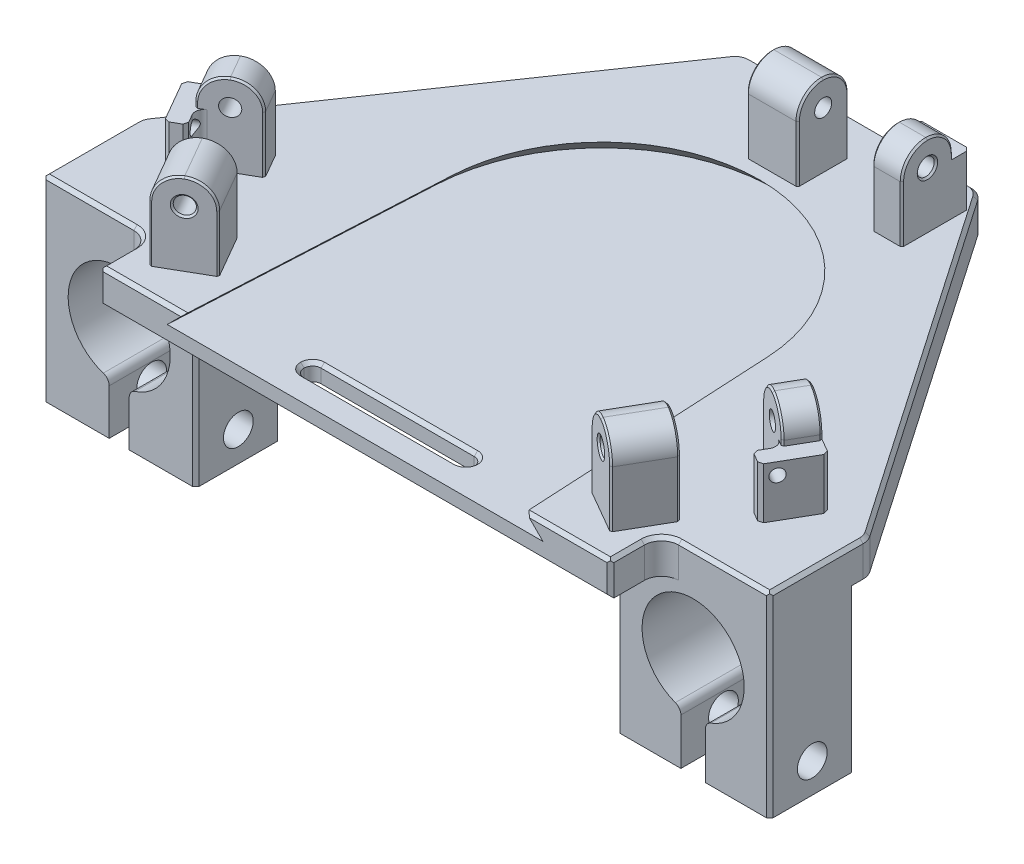
from build123d import *

# Parameters (mm, degrees)
SKETCH1_R                = 20
BOSS_EXTRUDE1_DEPTH      = 1
SKETCH3_W                = 3
SKETCH3_H                = 3
BOSS_EXTRUDE2_DEPTH      = 4.8
FILLET1_R                = 1.5
SKETCH4_R                = 0.5
CUT_EXTRUDE1_DEPTH       = 29.872824593
CIRPATTERN1_COUNT        = 3
FILLET1_OF_CIRPATTERN1_R = 1.5
BOSS_EXTRUDE6_DEPTH      = 2
CUT_EXTRUDE15_DEPTH      = 27
FILLET28_R               = 5
FILLET30_R               = 5
SKETCH12_W               = 9
SKETCH12_H               = 5
BOSS_EXTRUDE11_DEPTH     = 9.5
SKETCH36_R               = 3
CUT_EXTRUDE16_DEPTH      = 40.5
SKETCH41_W               = 1.75
SKETCH41_H               = 3
BOSS_EXTRUDE12_DEPTH     = 4.8
SKETCH48_W               = 3
SKETCH48_H               = 3
BOSS_EXTRUDE13_DEPTH     = 1
SKETCH49_W               = 3
SKETCH49_H               = 3
BOSS_EXTRUDE14_DEPTH     = 1
SKETCH50_W               = 3
SKETCH50_H               = 3
BOSS_EXTRUDE15_DEPTH     = 1
FILLET47_R               = 1.5
SKETCH42_R               = 0.5
CUT_EXTRUDE20_DEPTH      = 10
SKETCH43_R               = 0.5
CUT_EXTRUDE21_DEPTH      = 10
CUT_EXTRUDE22_START      = -10
SKETCH44_R               = 0.5
CUT_EXTRUDE22_DEPTH      = 10
SKETCH46_R               = 0.875
CUT_EXTRUDE23_DEPTH      = 51.492139351
SKETCH47_W               = 1.176481785
SKETCH47_H               = 10.74600376
SKETCH47_W_2             = 1.36989631
SKETCH47_W_3             = 1.437294726
CUT_EXTRUDE24_DEPTH      = 39.217742009
FILLET48_R               = 0.5
SKETCH51_R               = 0.375
CUT_EXTRUDE25_DEPTH      = 10.5
SKETCH53_R               = 0.375
CUT_EXTRUDE26_DEPTH      = 10.5
SKETCH52_R               = 0.375
CUT_EXTRUDE27_DEPTH      = 10.5
CHAMFER1_SIZE            = 0.1
CHAMFER2_SIZE            = 0.1
SKETCH54_W               = 53.79472753
SKETCH54_H               = 13.774888828
CUT_EXTRUDE28_DEPTH      = 9
CUT_EXTRUDE29_DEPTH      = 1
CUT_EXTRUDE29_DRAFT      = 45
CHAMFER3_SIZE            = 0.1
FILLET49_R               = 0.5
SKETCH57_OUTSIDE_W       = 61.414
SKETCH57_OUTSIDE_H       = 44.818
CUT_EXTRUDE31_DEPTH      = 3
SKETCH56_W               = 10
SKETCH56_H               = 1
CUT_EXTRUDE30_DEPTH      = 3
FILLET50_R               = 0.5
CHAMFER5_SIZE            = 0.2
FILLET51_R               = 1
CHAMFER4_SIZE            = 0.2
CHAMFER7_SIZE            = 0.2
FILLET52_R               = 1
CHAMFER6_SIZE            = 0.2


# Some blends are built 0.0001 mm under size
with BuildPart() as part:
    # Sketch1 → Boss-Extrude1 (new, symmetric)
    with BuildSketch(Plane(origin=(0, 0, 0), x_dir=(1, 0, 0), z_dir=(0, 1, 0))):
        with Locations(Location((0, 0, 0), (0, 0, 270))):
            Circle(SKETCH1_R)
    extrude(amount=BOSS_EXTRUDE1_DEPTH, both=True)

    # Sketch3 → Boss-Extrude2 (add)
    with BuildSketch(Plane(origin=(0, 1, 0), x_dir=(1, 0, 0), z_dir=(0, 1, 0))):
        with Locations((0, 15)):
            Rectangle(SKETCH3_W, SKETCH3_H)
    boss_extrude2 = extrude(amount=BOSS_EXTRUDE2_DEPTH)

    # Fillet1
    fillet1_edges = [part.edges().sort_by_distance(p)[0] for p in [
        (0, 5.8, -16.5),
        (0, 5.8, -13.5),
    ]]
    fillet(fillet1_edges, radius=FILLET1_R - 0.0001)  # a hair under: the kernel refuses the full size

    # Sketch4 → Cut-Extrude1 (cut, symmetric)
    with BuildSketch(Plane.ZY):
        with Locations((-15, 4.3)):
            Circle(SKETCH4_R)
    cut_extrude1 = extrude(amount=CUT_EXTRUDE1_DEPTH, both=True, mode=Mode.SUBTRACT)

    # CirPattern1: Boss-Extrude2, Cut-Extrude1 ×3 about axis
    cirpattern1_axis = Axis((0, 0, 0), (0, 1, 0))
    add([boss_extrude2.rotate(cirpattern1_axis, i * 360 / CIRPATTERN1_COUNT) for i in range(1, CIRPATTERN1_COUNT)])
    add([cut_extrude1.rotate(cirpattern1_axis, i * 360 / CIRPATTERN1_COUNT) for i in range(1, CIRPATTERN1_COUNT)], mode=Mode.SUBTRACT)

    # Fillet1 of CirPattern1
    fillet1_of_cirpattern1_edges = [part.edges().sort_by_distance(p)[0] for p in [
        (-14.289419162, 5.8, 8.25),
        (-11.691342951, 5.8, 6.75),
        (14.289419162, 5.8, 8.25),
        (11.691342951, 5.8, 6.75),
    ]]
    fillet(fillet1_of_cirpattern1_edges, radius=FILLET1_OF_CIRPATTERN1_R - 0.0001)  # a hair under: the kernel refuses the full size

    # Sketch14 → Boss-Extrude6 (add)
    with BuildSketch(Plane(origin=(0, 1, 0), x_dir=(1, 0, 0), z_dir=(0, 1, 0))):
        with BuildLine():
            ThreePointArc((-12.99118366, -15.206220672), (-18.163475345, -8.371867379), (-20, 0))
            Line((-20, 0), (-23.806849355, -4.715224683))
            Line((-23.806849355, -4.715224683), (-23.806849355, -8.719174362))
            Line((-23.806849355, -8.719174362), (-12.99118366, -15.206220672))
        make_face()
        with BuildLine():
            Line((12.99118366, -15.206220672), (23.806849355, -8.719174362))
            Line((23.806849355, -8.719174362), (23.806849355, -4.715224683))
            Line((23.806849355, -4.715224683), (20, 0))
            ThreePointArc((20, 0), (18.163475345, -8.371867379), (12.99118366, -15.206220672))
        make_face()
    extrude(amount=-BOSS_EXTRUDE6_DEPTH)

    # Sketch35 → Cut-Extrude15 (cut)
    with BuildSketch(Plane(origin=(0, 1, 0), x_dir=(1, 0, 0), z_dir=(0, 1, 0))):
        with BuildLine():
            Line((-20, 0), (-8.719101331, 17.999368655))
            ThreePointArc((-8.719101331, 17.999368655), (-18.922490972, 11.859455035), (-20, 0))
        make_face()
        with BuildLine():
            Line((8.719101331, 17.999368655), (20, 0))
            ThreePointArc((20, 0), (19.339121725, 12.120573599), (8.719101331, 17.999368655))
        make_face()
    extrude(amount=-CUT_EXTRUDE15_DEPTH, mode=Mode.SUBTRACT)

    # Fillet28
    fillet28_edges = [part.edges().sort_by_distance(p)[0] for p in [
        (-8.719101331, 0, -17.999368655),
        (8.719101331, 0, -17.999368655),
    ]]
    fillet(fillet28_edges, radius=FILLET28_R)

    # Fillet30
    # the kernel refuses this fillet: 5 mm, written as the material it adds along each edge
    with BuildSketch(Plane(origin=(20, 1, 0), x_dir=(-0.5310578751225382, 0, -0.8473355493960669), z_dir=(0, -1, 0))) as fillet30_piece_1:
        with BuildLine():
            CenterArc((FILLET30_R * 0.0597507997146, FILLET30_R), FILLET30_R, 263.161193514, 6.838806486)
            Line((-FILLET30_R * 0.0593256778676, FILLET30_R * 0.00711491476272), (0, 0))
            Line((0, 0), (FILLET30_R * 0.0597507997145, 0))
        make_face()
    extrude(amount=2)
    with BuildSketch(Plane(origin=(-20, 1, 0), x_dir=(0.5310578751225483, 0, -0.8473355493960607), z_dir=(0, -1, 0))) as fillet30_piece_2:
        with BuildLine():
            CenterArc((FILLET30_R * 0.0597507997145, -FILLET30_R), FILLET30_R, 90, 6.838806486)
            Line((-FILLET30_R * 0.0593256778676, -FILLET30_R * 0.00711491476272), (0, 0))
            Line((0, 0), (FILLET30_R * 0.0597507997145, 0))
        make_face()
    extrude(amount=2)
    # the kernel refuses this fillet: 5 mm, written as the material it takes off along each edge
    with BuildSketch(Plane(origin=(-23.806849355, 8.078700281, 8.719174362), x_dir=(0, 0, -1), z_dir=(0, -1, 0)), Plane(origin=(23.806849355, 8.078700281, 8.719174362), x_dir=(-0.8575752286007334, 0, 0.514358559071782), z_dir=(0, -1, 0))) as fillet30_2_piece_1:
        with BuildLine():
            CenterArc((FILLET30_R * 0.566296022473, FILLET30_R), FILLET30_R, 210.954589815, 59.045410185)
            Line((-FILLET30_R * 0.291279206127, FILLET30_R * 0.485641440928), (0, 0))
            Line((0, 0), (FILLET30_R * 0.566296022473, 0))
        make_face()
    extrude(amount=16.157400562, mode=Mode.SUBTRACT)
    with BuildSketch(Plane(origin=(-23.806849355, 5.416144051, 4.715224683), x_dir=(0.6281771761591642, 0, -0.7780703280248503), z_dir=(0, -1, 0))) as fillet30_2_piece_2:
        with BuildLine():
            CenterArc((FILLET30_R * 0.353291524108, FILLET30_R), FILLET30_R, 231.084234427, 38.915765573)
            Line((-FILLET30_R * 0.274885652051, FILLET30_R * 0.221929671975), (0, 0))
            Line((0, 0), (FILLET30_R * 0.353291524108, 0))
        make_face()
    extrude(amount=10.832288103, mode=Mode.SUBTRACT)
    with BuildSketch(Plane(origin=(23.806849355, 5.416144051, 4.715224683), x_dir=(-0.6281771761591636, 0, -0.778070328024851), z_dir=(0, -1, 0))) as fillet30_2_piece_3:
        with BuildLine():
            CenterArc((FILLET30_R * 0.353291524108, -FILLET30_R), FILLET30_R, 90, 38.915765573)
            Line((-FILLET30_R * 0.274885652051, -FILLET30_R * 0.221929671975), (0, 0))
            Line((0, 0), (FILLET30_R * 0.353291524108, 0))
        make_face()
    extrude(amount=10.832288103, mode=Mode.SUBTRACT)

    # Sketch12 → Boss-Extrude11 (add)
    with BuildSketch(Plane.XZ.offset(1)):
        with Locations((-16.859549072, 5.5)):
            Rectangle(SKETCH12_W, SKETCH12_H)
        with Locations((16.859549072, 5.5)):
            Rectangle(SKETCH12_W, SKETCH12_H)
        with Locations((-1.5, -16.25)):
            Rectangle(SKETCH12_W, SKETCH12_H)
    extrude(amount=BOSS_EXTRUDE11_DEPTH)

    # Sketch36 → Cut-Extrude16 (cut, symmetric)
    with BuildSketch(Plane(origin=(0, 0, 3), x_dir=(-1, 0, 0), z_dir=(0, 0, -1))):
        with Locations((-16.859549072, -4.5)):
            Circle(SKETCH36_R)
        with Locations((16.859549072, -4.5)):
            Circle(SKETCH36_R)
        with Locations((1.5, -4.5)):
            Circle(SKETCH36_R)
    extrude(amount=CUT_EXTRUDE16_DEPTH, both=True, mode=Mode.SUBTRACT)

    # Sketch41 → Boss-Extrude12 (add)
    with BuildSketch(Plane(origin=(0, 1, 0), x_dir=(1, 0, 0), z_dir=(0, 1, 0))):
        with Locations((6.75, 15)):
            Rectangle(SKETCH41_W, SKETCH41_H)
        Polygon((15.503842951, -0.146556296), (18.101919162, -1.646556296), (17.226919162, -3.162100753), (14.628842951, -1.662100753), align=None)
        Polygon((-14.628842951, -1.662100753), (-15.503842951, -0.146556296), (-18.101919162, -1.646556296), (-17.226919162, -3.162100753), align=None)
    extrude(amount=BOSS_EXTRUDE12_DEPTH)

    # Sketch48 → Boss-Extrude13 (add)
    with BuildSketch(Plane(origin=(0, 0, -16.5), x_dir=(-1, 0, 0), z_dir=(0, 0, -1))):
        with Locations((-6.125, 2.5)):
            Rectangle(SKETCH48_W, SKETCH48_H)
    extrude(amount=BOSS_EXTRUDE13_DEPTH)

    # Sketch49 → Boss-Extrude14 (add)
    with BuildSketch(Plane(origin=(14.289419162, 0, 8.25), x_dir=(0.5000000000000007, 0, -0.8660254037844384), z_dir=(0.8660254037844383, 0, 0.5000000000000006))):
        with Locations((6.125, 2.5)):
            Rectangle(SKETCH49_W, SKETCH49_H)
    extrude(amount=BOSS_EXTRUDE14_DEPTH)

    # Sketch50 → Boss-Extrude15 (add)
    with BuildSketch(Plane(origin=(-14.289419162, 0, 8.25), x_dir=(0.5000000000000007, 0, 0.8660254037844384), z_dir=(-0.8660254037844383, 0, 0.5000000000000006))):
        with Locations((-6.125, 2.5)):
            Rectangle(SKETCH50_W, SKETCH50_H)
    extrude(amount=BOSS_EXTRUDE15_DEPTH)

    # Fillet47
    fillet47_edges = [part.edges().sort_by_distance(p)[0] for p in [
        (6.75, 5.8, -16.5),
        (6.75, 5.8, -13.5),
        (15.066342951, 5.8, 0.904328524),
        (17.664419162, 5.8, 2.404328524),
        (-15.066342951, 5.8, 0.904328524),
        (-17.664419162, 5.8, 2.404328524),
    ]]
    fillet(fillet47_edges, radius=FILLET47_R - 0.0001)  # a hair under: the kernel refuses the full size

    # Sketch42 → Cut-Extrude20 (cut)
    with BuildSketch(Plane.ZY.offset(-5.875)):
        with Locations((-15, 4.3)):
            Circle(SKETCH42_R)
    extrude(amount=-CUT_EXTRUDE20_DEPTH, mode=Mode.SUBTRACT)

    # Sketch43 → Cut-Extrude21 (cut)
    with BuildSketch(Plane(origin=(-2.9375, 0, -5.087899247), x_dir=(0.8660254037844387, 0, -0.4999999999999999), z_dir=(0.49999999999999994, 0, 0.8660254037844388))):
        with Locations((-15, 4.3)):
            Circle(SKETCH43_R)
    extrude(amount=-CUT_EXTRUDE21_DEPTH, mode=Mode.SUBTRACT)

    # Sketch44 → Cut-Extrude22 (cut)
    with BuildSketch(Plane(origin=(2.9375, 0, -5.087899247), x_dir=(0.8660254037844387, 0, 0.49999999999999983), z_dir=(-0.49999999999999983, 0, 0.8660254037844387)).offset(CUT_EXTRUDE22_START)):
        with Locations(Location((15, 4.3, 0), (0, 0, 180))):
            Circle(SKETCH44_R)
    extrude(amount=CUT_EXTRUDE22_DEPTH, mode=Mode.SUBTRACT)

    # Sketch46 → Cut-Extrude23 (cut, through all)
    with BuildSketch(Plane.ZY.offset(21.359549072)):
        with Locations((5.5, -8.75)):
            Circle(SKETCH46_R)
        with Locations((-16.25, -8.75)):
            Circle(SKETCH46_R)
    extrude(amount=-CUT_EXTRUDE23_DEPTH, mode=Mode.SUBTRACT)

    # Sketch47 → Cut-Extrude24 (cut, through all)
    with BuildSketch(Plane.XY.offset(8)):
        with Locations((-16.859549072, -10.5)):
            Rectangle(SKETCH47_W, SKETCH47_H)
        with Locations((-1.5, -10.5)):
            Rectangle(SKETCH47_W_2, SKETCH47_H)
        with Locations((16.859549072, -10.5)):
            Rectangle(SKETCH47_W_3, SKETCH47_H)
    extrude(amount=-CUT_EXTRUDE24_DEPTH, mode=Mode.SUBTRACT)

    # Fillet48
    fillet48_edges = [part.edges().sort_by_distance(p)[0] for p in [
        (5.875, 2.5, -16.5),
        (17.226919162, 2.5, 3.162100753),
        (-17.226919162, 2.5, 3.162100753),
    ]]
    fillet(fillet48_edges, radius=FILLET48_R)

    # Sketch51 → Cut-Extrude25 (cut)
    with BuildSketch(Plane(origin=(-15.155444566, 0, 8.75), x_dir=(0.5000000000000008, 0, 0.8660254037844383), z_dir=(-0.8660254037844382, 0, 0.5000000000000007))):
        with Locations((-5.425, 3.3)):
            Circle(SKETCH51_R)
    extrude(amount=-CUT_EXTRUDE25_DEPTH, mode=Mode.SUBTRACT)

    # Sketch53 → Cut-Extrude26 (cut)
    with BuildSketch(Plane(origin=(15.155444566, 0, 8.75), x_dir=(0.5000000000000006, 0, -0.8660254037844384), z_dir=(0.8660254037844384, 0, 0.5000000000000006))):
        with Locations((5.425, 3.3)):
            Circle(SKETCH53_R)
    extrude(amount=-CUT_EXTRUDE26_DEPTH, mode=Mode.SUBTRACT)

    # Sketch52 → Cut-Extrude27 (cut)
    with BuildSketch(Plane(origin=(0, 0, -17.5), x_dir=(-1, 0, 0), z_dir=(0, 0, -1))):
        with Locations((-5.425, 3.3)):
            Circle(SKETCH52_R)
    extrude(amount=-CUT_EXTRUDE27_DEPTH, mode=Mode.SUBTRACT)

    # Chamfer1
    chamfer1_edges = [part.edges().sort_by_distance(p)[0] for p in [
        (-1.5, 2.65005, -13.5),
        (-1.5, 2.65005, -16.5),
        (-1.5, 5.360689461, -13.939310539),
        (-1.5, 5.360689461, -16.060689461),
        (1.5, 2.65005, -16.5),
        (1.5, 2.65005, -13.5),
        (1.5, 5.360689461, -13.939310539),
        (1.5, 5.360689461, -16.060689461),
        (12.441342951, 2.65005, 5.450961894),
        (15.039419162, 2.65005, 6.950961894),
        (12.821797038, 5.360689461, 5.670617164),
        (14.658965076, 5.360689461, 6.731306625),
        (13.539419162, 2.65005, 9.549038106),
        (10.941342951, 2.65005, 8.049038106),
        (11.321797038, 5.360689461, 8.268693375),
        (13.158965076, 5.360689461, 9.329382836),
        (-10.941342951, 2.65005, 8.049038106),
        (-13.539419162, 2.65005, 9.549038106),
        (-11.321797038, 5.360689461, 8.268693375),
        (-13.158965076, 5.360689461, 9.329382836),
        (-15.039419162, 2.65005, 6.950961894),
        (-12.441342951, 2.65005, 5.450961894),
        (-12.821797038, 5.360689461, 5.670617164),
        (-14.658965076, 5.360689461, 6.731306625),
    ]]
    chamfer(chamfer1_edges, length=CHAMFER1_SIZE)

    # Chamfer2
    chamfer2_edges = [part.edges().sort_by_distance(p)[0] for p in [
        (5.875, 2.65005, -13.5),
        (5.875, 4.15005, -16.5),
        (5.875, 5.360689461, -13.939310539),
        (5.875, 5.360689461, -16.060689461),
        (7.625, 4.15005, -16.5),
        (7.625, 2.65005, -13.5),
        (7.625, 5.360689461, -13.939310539),
        (7.625, 5.360689461, -16.060689461),
        (17.226919162, 4.15005, 3.162100753),
        (14.628842951, 2.65005, 1.662100753),
        (16.846465076, 5.360689461, 2.942445483),
        (15.009297038, 5.360689461, 1.881756022),
        (15.503842951, 2.65005, 0.146556296),
        (18.101919162, 4.15005, 1.646556296),
        (17.721465076, 5.360689461, 1.426901027),
        (15.884297038, 5.360689461, 0.366211566),
        (-18.101919162, 4.15005, 1.646556296),
        (-15.503842951, 2.65005, 0.146556296),
        (-17.721465076, 5.360689461, 1.426901027),
        (-15.884297038, 5.360689461, 0.366211566),
        (-14.628842951, 2.65005, 1.662100753),
        (-17.226919162, 4.15005, 3.162100753),
        (-16.846465076, 5.360689461, 2.942445483),
        (-15.009297038, 5.360689461, 1.881756022),
    ]]
    chamfer(chamfer2_edges, length=CHAMFER2_SIZE)

    # Sketch54 → Cut-Extrude28 (cut)
    with BuildSketch(Plane.XY.offset(20)):
        Rectangle(SKETCH54_W, SKETCH54_H)
    extrude(amount=-CUT_EXTRUDE28_DEPTH, mode=Mode.SUBTRACT)


with BuildPart() as cut_extrude29_tool:
    # Sketch55 → Cut-Extrude29 (with draft: the straight prism first)
    with BuildSketch(Plane(origin=(0, 1, 0), x_dir=(1, 0, 0), z_dir=(0, 1, 0))):
        with BuildLine():
            Line((-10.035318621, -11), (10.035318621, -11))
            Line((10.035318621, -11), (9.25, 3.984771958))
            ThreePointArc((9.25, 3.984771958), (0, 12.7626942), (-9.25, 3.984771958))
            Line((-9.25, 3.984771958), (-10.035318621, -11))
        make_face()
    extrude(amount=-CUT_EXTRUDE29_DEPTH)
    # Cut-Extrude29: the draft: its side faces are tilted about the plane it starts from
    cut_extrude29_sides = [cut_extrude29_tool.faces().sort_by_distance(p)[0] for p in [
        (-9.642659311, 0.5, 3.507614021),
        (0, 0.5, 11),
        (9.642659311, 0.5, 3.507614021),
        (0, 0.5, -12.7626942),
    ]]
    draft(cut_extrude29_sides, Plane(origin=(0, 1, 0), x_dir=(1, 0, 0), z_dir=(0, 1, 0)), CUT_EXTRUDE29_DRAFT)


with BuildPart() as part_1:
    add(part.part)

    # Cut-Extrude29: cut by cut_extrude29_tool
    add(cut_extrude29_tool.part, mode=Mode.SUBTRACT)

    # Chamfer3
    chamfer3_edges = [part_1.edges().sort_by_distance(p)[0] for p in [
        (-1.5, 4.3, -15.5),
        (7.625, 4.3, -15.5),
        (-17.235893759, 4.3, 1.146556296),
        (17.235893759, 4.3, 1.146556296),
        (12.673393759, 4.3, 9.049038106),
        (-12.673393759, 4.3, 9.049038106),
    ]]
    chamfer(chamfer3_edges, length=CHAMFER3_SIZE)

    # Fillet49
    fillet49_edges = [part_1.edges().sort_by_distance(p)[0] for p in [
        (-16.271308179, -7.441763528, 5.5),
        (-17.447789964, -7.441763528, 5.5),
        (-0.815051845, -7.420761206, -16.25),
        (-2.184948155, -7.420761206, -16.25),
        (17.578196435, -7.412652737, 5.5),
        (16.140901709, -7.412652737, 5.5),
    ]]
    fillet(fillet49_edges, radius=FILLET49_R)

    # Sketch57 outside → Cut-Extrude31 (cut)
    with BuildSketch(Plane.XZ.offset(1)):
        with Locations((0, -4.5)):
            Rectangle(SKETCH57_OUTSIDE_W, SKETCH57_OUTSIDE_H)
        Polygon((-15, 11), (-15, 8), (-21.359549072, 8), (-21.359549072, 2.2), (-6.959705454, -18.75), (6.959705454, -18.75), (21.359549072, 2.2), (21.359549072, 8), (15, 8), (15, 11), align=None, mode=Mode.SUBTRACT)
    extrude(amount=-CUT_EXTRUDE31_DEPTH, mode=Mode.SUBTRACT)

    # Sketch56 → Cut-Extrude30 (cut)
    with BuildSketch(Plane(origin=(0, 0, 0), x_dir=(1, 0, 0), z_dir=(0, 1, 0))):
        with Locations((0, -9)):
            Rectangle(SKETCH56_W, SKETCH56_H)
    extrude(amount=-CUT_EXTRUDE30_DEPTH, mode=Mode.SUBTRACT)

    # Fillet50
    fillet50_edges = [part_1.edges().sort_by_distance(p)[0] for p in [
        (5, -0.5, 9.5),
        (5, -0.5, 8.5),
        (-5, -0.5, 8.5),
        (-5, -0.5, 9.5),
    ]]
    fillet(fillet50_edges, radius=FILLET50_R - 0.0001)  # a hair under: the kernel refuses the full size

    # Chamfer5
    chamfer5_edges = [part_1.edges().sort_by_distance(p)[0] for p in [
        (4.625, 2.5, -16.5),
        (7.625, 2.5, -17.5),
        (4.625, 2.5, -17.5),
        (16.601919162, 2.5, 4.244632507),
        (18.967944566, 2.5, 2.146556296),
        (17.467944566, 2.5, 4.744632507),
        (-16.601919162, 2.5, 4.244632507),
        (-18.967944566, 2.5, 2.146556296),
        (-17.467944566, 2.5, 4.744632507),
    ]]
    chamfer(chamfer5_edges, length=CHAMFER5_SIZE)

    # Fillet51
    fillet51_edges = [part_1.edges().sort_by_distance(p)[0] for p in [
        (15, 0, 8),
        (-15, 0, 8),
    ]]
    fillet(fillet51_edges, radius=FILLET51_R)

    # Chamfer4
    chamfer4_edges = [part_1.edges().sort_by_distance(p)[0] for p in [
        (-21.359549072, -4.75, 8),
        (-21.359549072, -5.75, 3),
        (-12.359549072, -5.75, 3),
        (-12.359549072, -5.75, 8),
        (21.359549072, -5.75, 3),
        (21.359549072, -4.75, 8),
        (12.359549072, -5.75, 8),
        (12.359549072, -5.75, 3),
        (-6, -5.75, -13.75),
        (-6, -5.75, -18.75),
        (3, -5.75, -18.75),
        (3, -5.75, -13.75),
    ]]
    chamfer(chamfer4_edges, length=CHAMFER4_SIZE)

    # Chamfer7
    chamfer7_edges = [part_1.edges().sort_by_distance(p)[0] for p in [
        (15, 0, 11),
        (-15, 0, 11),
    ]]
    chamfer(chamfer7_edges, length=CHAMFER7_SIZE)

    # Fillet52
    fillet52_edges = [part_1.edges().sort_by_distance(p)[0] for p in [
        (21.359549072, 0, 2.2),
        (6.959705454, 0, -18.75),
        (-6.959705454, 0, -18.75),
        (-21.359549072, 0, 2.2),
    ]]
    fillet(fillet52_edges, radius=FILLET52_R)

    # Chamfer6
    # the kernel refuses this chamfer: 0.2 mm, written as the material it takes off along each edge
    with BuildSketch(Plane(origin=(-4.5001, 0, 8.5), x_dir=(0, 0.027495876610586487, -0.9996219169112966), z_dir=(1, 0, 0)), Plane(origin=(4.5001, 0, 9.5), x_dir=(0, 0.027495876610586487, 0.9996219169112966), z_dir=(-1, 0, 0))) as chamfer6_piece_1:
        Polygon((CHAMFER6_SIZE * 0.999621916911, -CHAMFER6_SIZE * 0.0274958766106), (-CHAMFER6_SIZE * 0.0274958766106, -CHAMFER6_SIZE * 0.999621916911), (0, 0), align=None)
    extrude(amount=9.0002, mode=Mode.SUBTRACT)
    with BuildSketch(Plane(origin=(-4.5001, 0, 8.9999), x_dir=(-1, 0, 0), z_dir=(0, 0, 1))) as chamfer6_piece_2:
        Polygon((0.4999 + CHAMFER6_SIZE, 0), (0.4999, CHAMFER6_SIZE), (0.4999, 0), align=None)
    revolve(axis=Axis((-4.5001, 0, 8.9999), (0, -1, 0)), revolution_arc=90, mode=Mode.SUBTRACT)
    with BuildSketch(Plane(origin=(4.5001, 0, 8.9999), x_dir=(1, 0, 0), z_dir=(0, 0, 1))) as chamfer6_piece_3:
        Polygon((0.4999 + CHAMFER6_SIZE, 0), (0.4999, -CHAMFER6_SIZE), (0.4999, 0), align=None)
    revolve(axis=Axis((4.5001, 0, 8.9999), (0, 1, 0)), revolution_arc=90, mode=Mode.SUBTRACT)
    with BuildSketch(Plane(origin=(-4.5001, 0, 9.0001), x_dir=(-1, 0, 0), z_dir=(0, 0, -1))) as chamfer6_piece_4:
        Polygon((0.4999 + CHAMFER6_SIZE, 0), (0.4999, -CHAMFER6_SIZE), (0.4999, 0), align=None)
    revolve(axis=Axis((-4.5001, 0, 9.0001), (0, 1, 0)), revolution_arc=90, mode=Mode.SUBTRACT)
    with BuildSketch(Plane(origin=(4.5001, 0, 9.0001), x_dir=(0, 0, 1), z_dir=(-1, 0, 0))) as chamfer6_piece_5:
        Polygon((0.4999 + CHAMFER6_SIZE, 0), (0.4999, -CHAMFER6_SIZE), (0.4999, 0), align=None)
    revolve(axis=Axis((4.5001, 0, 9.0001), (0, 1, 0)), revolution_arc=90, mode=Mode.SUBTRACT)
    with BuildSketch(Plane(origin=(15.314336598, -1, 11), x_dir=(0, 0.9996219169112966, 0.02749587661058736), z_dir=(-1, 0, 0))) as chamfer6_piece_6:
        Polygon((CHAMFER6_SIZE * 0.999621916911, CHAMFER6_SIZE * 0.0274958766106), (-CHAMFER6_SIZE * 0.0274958766106, CHAMFER6_SIZE * 0.999621916911), (0, 0), align=None)
    extrude(amount=30.628673195, mode=Mode.SUBTRACT)
    with BuildSketch(Plane(origin=(9.520982024, 1, 11), x_dir=(0, 0.027495876610587052, -0.9996219169112966), z_dir=(1, 0, 0)), Plane(origin=(-15.314336598, 1, 11), x_dir=(0, 0.02749587661058682, -0.9996219169112968), z_dir=(1, 0, 0))) as chamfer6_piece_7:
        Polygon((CHAMFER6_SIZE * 0.999621916911, -CHAMFER6_SIZE * 0.0274958766106), (-CHAMFER6_SIZE * 0.0274958766106, -CHAMFER6_SIZE * 0.999621916911), (0, 0), align=None)
    extrude(amount=5.793354574, mode=Mode.SUBTRACT)
    with BuildSketch(Plane(origin=(15, 1, 11.314336598), x_dir=(-0.9996219169112966, 0.027495876610588842, 0), z_dir=(0, 0, -1)), Plane(origin=(-15, 1, 9), x_dir=(0.9996219169112966, 0.02749587661058634, 0), z_dir=(0, 0, 1))) as chamfer6_piece_8:
        Polygon((CHAMFER6_SIZE * 0.999621916911, -CHAMFER6_SIZE * 0.0274958766106), (-CHAMFER6_SIZE * 0.0274958766106, -CHAMFER6_SIZE * 0.999621916911), (0, 0), align=None)
    extrude(amount=2.314336598, mode=Mode.SUBTRACT)
    with BuildSketch(Plane(origin=(16, 1, 9), x_dir=(0, 0, -1), z_dir=(1, 0, 0))) as chamfer6_piece_9:
        Polygon((1 + CHAMFER6_SIZE, 0), (1, -CHAMFER6_SIZE), (1, 0), align=None)
    revolve(axis=Axis((16, 1, 9), (0, 1, 0)), revolution_arc=90, mode=Mode.SUBTRACT)
    with BuildSketch(Plane(origin=(16, 1, 8), x_dir=(0, 0.027495876610586223, -0.9996219169112966), z_dir=(1, 0, 0)), Plane(origin=(-21.673885669, 1, 8), x_dir=(0, 0.027495876610586462, -0.9996219169112968), z_dir=(1, 0, 0))) as chamfer6_piece_10:
        Polygon((CHAMFER6_SIZE * 0.999621916911, -CHAMFER6_SIZE * 0.0274958766106), (-CHAMFER6_SIZE * 0.0274958766106, -CHAMFER6_SIZE * 0.999621916911), (0, 0), align=None)
    extrude(amount=5.673885669, mode=Mode.SUBTRACT)
    with BuildSketch(Plane(origin=(21.359549072, 1, 8.314336598), x_dir=(-0.9996219169112966, 0.02749587661058908, 0), z_dir=(0, 0, -1)), Plane(origin=(-21.359549072, 1, 2.510531491), x_dir=(0.9996219169112968, 0.02749587661058658, 0), z_dir=(0, 0, 1))) as chamfer6_piece_11:
        Polygon((CHAMFER6_SIZE * 0.999621916911, -CHAMFER6_SIZE * 0.0274958766106), (-CHAMFER6_SIZE * 0.0274958766106, -CHAMFER6_SIZE * 0.999621916911), (0, 0), align=None)
    extrude(amount=5.803805106, mode=Mode.SUBTRACT)
    with BuildSketch(Plane(origin=(20.359549072, 1, 2.510531491), x_dir=(1, 0, 0), z_dir=(0, 0, 1))) as chamfer6_piece_12:
        Polygon((1 - CHAMFER6_SIZE, 0), (1, -CHAMFER6_SIZE), (1, 0), align=None)
    revolve(axis=Axis((20.359549072, 1, 2.510531491), (0, 1, 0)), revolution_arc=34.502428661, mode=Mode.SUBTRACT)
    with BuildSketch(Plane(origin=(21.183651251, 1, 1.944090322), x_dir=(-0.8237905998853164, 0.027495876610588672, 0.5662270077539623), z_dir=(-0.5664411695809262, 0, -0.8241021789825534)), Plane(origin=(-7.257709241, 1, -18.31644117), x_dir=(0.8237905998853166, 0.027495876610586428, 0.5662270077539623), z_dir=(-0.5664411695809262, 0, 0.8241021789825534))) as chamfer6_piece_13:
        Polygon((CHAMFER6_SIZE * 0.999621916911, -CHAMFER6_SIZE * 0.0274958766106), (-CHAMFER6_SIZE * 0.0274958766106, -CHAMFER6_SIZE * 0.999621916911), (0, 0), align=None)
    extrude(amount=24.584975028, mode=Mode.SUBTRACT)
    with BuildSketch(Plane(origin=(6.433607062, 1, -17.75), x_dir=(0.8241021789825532, 0, -0.5664411695809265), z_dir=(0.5664411695809265, 0, 0.8241021789825532))) as chamfer6_piece_14:
        Polygon((1 - CHAMFER6_SIZE, 0), (1, -CHAMFER6_SIZE), (1, 0), align=None)
    revolve(axis=Axis((6.433607062, 1, -17.75), (0, 1, 0)), revolution_arc=55.497571339, mode=Mode.SUBTRACT)
    with BuildSketch(Plane(origin=(6.433607062, 1, -18.75), x_dir=(0, 0.02749587661058908, 0.9996219169112966), z_dir=(-1, 0, 0))) as chamfer6_piece_15:
        Polygon((CHAMFER6_SIZE * 0.999621916911, -CHAMFER6_SIZE * 0.0274958766106), (-CHAMFER6_SIZE * 0.0274958766106, -CHAMFER6_SIZE * 0.999621916911), (0, 0), align=None)
    extrude(amount=12.867214125, mode=Mode.SUBTRACT)
    with BuildSketch(Plane(origin=(-6.433607062, 1, -17.75), x_dir=(0, 0, -1), z_dir=(1, 0, 0))) as chamfer6_piece_16:
        Polygon((1 - CHAMFER6_SIZE, 0), (1, -CHAMFER6_SIZE), (1, 0), align=None)
    revolve(axis=Axis((-6.433607062, 1, -17.75), (0, 1, 0)), revolution_arc=55.497571339, mode=Mode.SUBTRACT)
    with BuildSketch(Plane(origin=(-20.359549072, 1, 2.510531491), x_dir=(-0.8241021789825534, 0, -0.5664411695809262), z_dir=(0.5664411695809262, 0, -0.8241021789825534))) as chamfer6_piece_17:
        Polygon((1 - CHAMFER6_SIZE, 0), (1, -CHAMFER6_SIZE), (1, 0), align=None)
    revolve(axis=Axis((-20.359549072, 1, 2.510531491), (0, 1, 0)), revolution_arc=34.502428661, mode=Mode.SUBTRACT)
    with BuildSketch(Plane(origin=(-16, 1, 9), x_dir=(1, 0, 0), z_dir=(0, 0, 1))) as chamfer6_piece_18:
        Polygon((1 + CHAMFER6_SIZE, 0), (1, -CHAMFER6_SIZE), (1, 0), align=None)
    revolve(axis=Axis((-16, 1, 9), (0, 1, 0)), revolution_arc=90, mode=Mode.SUBTRACT)
    with BuildSketch(Plane(origin=(5, 0, 8.9999), x_dir=(0.9996219169112968, 0.027495876610586313, 0), z_dir=(0, 0, 1)), Plane(origin=(-5, 0, 9.0001), x_dir=(-0.9996219169112968, 0.027495876610586313, 0), z_dir=(0, 0, -1))) as chamfer6_piece_19:
        Polygon((CHAMFER6_SIZE * 0.999621916911, -CHAMFER6_SIZE * 0.0274958766106), (-CHAMFER6_SIZE * 0.0274958766106, -CHAMFER6_SIZE * 0.999621916911), (0, 0), align=None)
    extrude(amount=0.0002, mode=Mode.SUBTRACT)


solid = part_1.part
